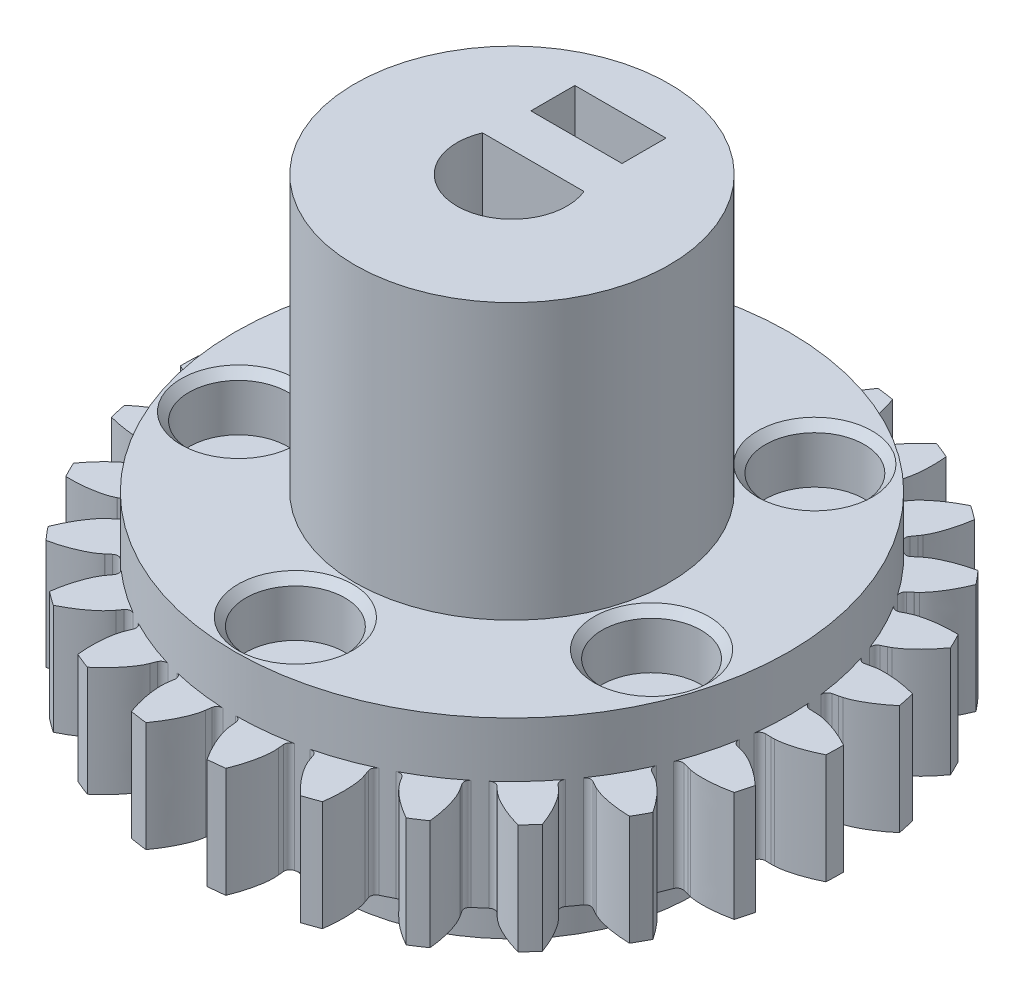
from build123d import *

# Parameters (mm, degrees)
BOSS_EXTRUDE2_DEPTH = 7
CIRPATTERN1_COUNT   = 26
FILLET2_R           = 0.375
SKETCH3_R           = 10
BOSS_EXTRUDE3_DEPTH = 21
CUT_EXTRUDE1_DEPTH  = 10
SKETCH6_R           = 1.6
CUT_EXTRUDE2_DEPTH  = 15
SKETCH8_W           = 5.8
SKETCH8_H           = 2.8
CUT_EXTRUDE4_DEPTH  = 8.8
SKETCH9_R           = 11.5
SKETCH9_R_2         = 9.65
BOSS_EXTRUDE4_DEPTH = 6
SKETCH10_R          = 17.625
SKETCH10_R_2        = 10
SKETCH10_R_3        = 3.15
BOSS_EXTRUDE5_DEPTH = 3.5
CHAMFER1_SIZE       = 0.5


with BuildPart() as part:
    # Sketch1 → Boss-Extrude2 (new body)
    with BuildSketch(Plane(origin=(0, 0, 0), x_dir=(1, 0, 0), z_dir=(0, 1, 0))):
        with BuildLine():
            add(Edge.make_bspline(
                [(13.04324728, 12.87221625), (13.106541248, 12.928570983), (13.172712284, 12.981186998), (13.241136986, 13.030696548)],
                knots=[0.000110235, 0.000110235, 0.000110235, 0.000110235, 0.070248199, 0.070248199, 0.070248199, 0.070248199], degree=3))
            Line((13.04324728, 12.87221625), (14.994199295, 10.921264235))
            add(Edge.make_bspline(
                [(14.994199295, 10.921264235), (15.156199197, 11.078539273), (15.298507984, 11.255888704), (15.431102636, 11.439593369)],
                knots=[0.062510625, 0.062510625, 0.062510625, 0.062510625, 0.250010852, 0.250010852, 0.250010852, 0.250010852], degree=3))
            Line((15.431102636, 11.439593369), (13.241136986, 13.030696548))
        make_face()
        with BuildLine():
            Line((14.994199295, 10.921264235), (13.04324728, 12.87221625))
            add(Edge.make_bspline(
                [(13.042948867, 12.871950507), (13.043048331, 12.872039097), (13.043147802, 12.872127678), (13.04324728, 12.87221625)],
                knots=[0, 0, 0, 0, 0.000110235, 0.000110235, 0.000110235, 0.000110235], degree=3))
            ThreePointArc((13.042948867, 12.871950507), (13.973627411, 11.855098565), (14.825236422, 10.771164748))
            add(Edge.make_bspline(
                [(14.825236422, 10.771164748), (14.912631208, 10.843375876), (14.994199295, 10.921264235)],
                knots=[0, 0, 0, 0.250031649, 0.250031649, 0.250031649], degree=2))
        make_face()
        with BuildLine():
            ThreePointArc((14.825236422, 10.771164748), (13.973627411, 11.855098565), (13.042948867, 12.871950507))
            Line((13.042948867, 12.871950507), (14.825236422, 10.771164748))
        make_face()
        with BuildLine():
            Line((14.825236422, 10.771164748), (13.042948867, 12.871950507))
            Line((13.042948867, 12.871950507), (12.507592838, 12.417759315))
            ThreePointArc((12.507592838, 12.417759315), (13.439846282, 11.402243503), (14.289880393, 10.316973556))
            Line((14.289880393, 10.316973556), (14.825236422, 10.771164748))
        make_face()
        with BuildLine():
            add(Edge.make_bspline(
                [(13.241136986, 13.030696548), (13.416508573, 13.157588856), (13.663595297, 13.295941653), (13.917955055, 13.417816485), (13.976901471, 13.4450413)],
                knots=[0.070248199, 0.070248199, 0.070248199, 0.070248199, 0.250010852, 0.303805728, 0.303805728, 0.303805728, 0.303805728], degree=3))
            Line((13.241136986, 13.030696548), (15.431102636, 11.439593369))
            add(Edge.make_bspline(
                [(15.431102636, 11.439593369), (15.652090738, 11.745763676), (15.846095862, 12.069586935), (16.017672277, 12.405216638)],
                knots=[0.250010852, 0.250010852, 0.250010852, 0.250010852, 0.562507008, 0.562507008, 0.562507008, 0.562507008], degree=3))
            Line((16.017672277, 12.405216638), (13.976901471, 13.4450413))
        make_face()
        with BuildLine():
            ThreePointArc((14.289880393, 10.316973556), (13.439846282, 11.402243503), (12.507592838, 12.417759315))
            ThreePointArc((12.507592838, 12.417759315), (-16.295504729, -6.715441208), (17.625, 0))
            ThreePointArc((17.625, 0), (16.770506357, 5.421322859), (14.289880393, 10.316973556))
        make_face()
        with BuildLine():
            add(Edge.make_bspline(
                [(13.976901471, 13.4450413), (14.5125687, 13.692442957), (15.077981381, 13.869949575), (15.653897684, 13.998410171)],
                knots=[0.303805728, 0.303805728, 0.303805728, 0.303805728, 0.792659062, 0.792659062, 0.792659062, 0.792659062], degree=3))
            Line((13.976901471, 13.4450413), (16.017672277, 12.405216638))
            add(Edge.make_bspline(
                [(16.017672277, 12.405216638), (16.144037556, 12.652406447), (16.258236925, 12.906000376), (16.362089788, 13.163662779)],
                knots=[0.562507008, 0.562507008, 0.562507008, 0.562507008, 0.792659062, 0.792659062, 0.792659062, 0.792659062], degree=3))
            ThreePointArc((16.362089788, 13.163662779), (16.013433868, 13.585651834), (15.653897684, 13.998410171))
        make_face()
    boss_extrude2 = extrude(amount=BOSS_EXTRUDE2_DEPTH)

    # CirPattern1: Boss-Extrude2 ×26 about axis
    cirpattern1_axis = Axis((0, -16.866091491, 0), (0, 1, 0))
    for i in range(1, CIRPATTERN1_COUNT):
        add(boss_extrude2.rotate(cirpattern1_axis, i * 360 / CIRPATTERN1_COUNT))

    # Fillet2
    fillet2_edges = [part.edges().sort_by_distance(p)[0] for p in [
        (11.816733548, 3.5, -14.006085579),
        (11.405629059, 3.5, -13.436973274),
        (9.172380602, 3.5, -15.050184686),
        (9.583485091, 3.5, -15.619296991),
        (8.121485073, 3.5, -16.427023626),
        (7.858524023, 3.5, -15.776064946),
        (5.304102946, 3.5, -16.807948029),
        (5.567063997, 3.5, -17.458906709),
        (3.954245406, 3.5, -17.89328277),
        (3.854710135, 3.5, -17.198309067),
        (1.127570107, 3.5, -17.588894526),
        (1.227105378, 3.5, -18.283868228),
        (-0.442800631, 3.5, -18.319649358),
        (-0.373125495, 3.5, -17.621049979),
        (-3.114493009, 3.5, -17.347638407),
        (-3.184168145, 3.5, -18.046237786),
        (-4.814112705, 3.5, -17.681344515),
        (-4.579276428, 3.5, -17.019719516),
        (-7.175553112, 3.5, -16.0982006),
        (-7.410389389, 3.5, -16.759825599),
        (-8.905646048, 3.5, -16.015464198),
        (-8.519296459, 3.5, -15.429264819),
        (-10.81959615, 3.5, -13.913193888),
        (-11.205945738, 3.5, -14.499393267),
        (-12.479615612, 3.5, -13.418823315),
        (-11.964205947, 3.5, -12.942117333),
        (-13.834843587, 3.5, -10.91960292),
        (-14.350253252, 3.5, -11.396308902),
        (-15.328315279, 3.5, -10.042329197),
        (-14.713799273, 3.5, -9.702821031),
        (-16.046060203, 3.5, -7.291404321),
        (-16.660576209, 3.5, -7.630912488),
        (-17.286188978, 3.5, -6.082211409),
        (-16.608280068, 3.5, -5.899632039),
        (-17.324738124, 3.5, -3.239455807),
        (-18.002647035, 3.5, -3.422035177),
        (-18.239452206, 3.5, -1.768617601),
        (-17.537547994, 3.5, -1.753577877),
        (-17.596565239, 3.5, 1.000758104),
        (-18.298469452, 3.5, 0.98571838),
        (-18.13270477, 3.5, 2.647761833),
        (-17.447597377, 3.5, 2.494387858),
        (-16.845743943, 3.5, 5.182811592),
        (-17.530851337, 3.5, 5.336185568),
        (-16.972150442, 3.5, 6.910262974),
        (-16.343655819, 3.5, 6.597388836),
        (-15.115909241, 3.5, 9.063658909),
        (-15.744403864, 3.5, 9.376533047),
        (-14.825236422, 3.5, 10.771164748),
        (-14.289880393, 3.5, 10.316973556),
        (-12.507592838, 3.5, 12.417759315),
        (-13.042948867, 3.5, 12.871950507),
        (-11.816733548, 3.5, 14.006085579),
        (-11.405629059, 3.5, 13.436973274),
        (-9.172380602, 3.5, 15.050184686),
        (-9.583485091, 3.5, 15.619296991),
        (-8.121485073, 3.5, 16.427023626),
        (-7.858524023, 3.5, 15.776064946),
        (-5.304102946, 3.5, 16.807948029),
        (-5.567063997, 3.5, 17.458906709),
        (-3.954245406, 3.5, 17.89328277),
        (-3.854710135, 3.5, 17.198309067),
        (-1.127570107, 3.5, 17.588894526),
        (-1.227105378, 3.5, 18.283868228),
        (0.442800631, 3.5, 18.319649358),
        (0.373125495, 3.5, 17.621049979),
        (3.114493009, 3.5, 17.347638407),
        (3.184168145, 3.5, 18.046237786),
        (4.814112705, 3.5, 17.681344515),
        (7.175553112, 3.5, 16.0982006),
        (7.410389389, 3.5, 16.759825599),
        (8.905646048, 3.5, 16.015464198),
        (10.81959615, 3.5, 13.913193888),
        (11.205945738, 3.5, 14.499393267),
        (12.479615612, 3.5, 13.418823315),
        (13.834843587, 3.5, 10.91960292),
        (14.350253252, 3.5, 11.396308902),
        (15.328315279, 3.5, 10.042329197),
        (16.046060203, 3.5, 7.291404321),
        (16.660576209, 3.5, 7.630912488),
        (17.286188978, 3.5, 6.082211409),
        (16.608280068, 3.5, 5.899632039),
        (17.324738124, 3.5, 3.239455807),
        (18.002647035, 3.5, 3.422035177),
        (18.239452206, 3.5, 1.768617601),
        (17.537547994, 3.5, 1.753577877),
        (17.596565239, 3.5, -1.000758104),
        (18.298469452, 3.5, -0.98571838),
        (18.13270477, 3.5, -2.647761833),
        (17.447597377, 3.5, -2.494387858),
        (16.845743943, 3.5, -5.182811592),
        (17.530851337, 3.5, -5.336185568),
        (16.972150442, 3.5, -6.910262974),
        (16.343655819, 3.5, -6.597388836),
        (15.115909241, 3.5, -9.063658909),
        (15.744403864, 3.5, -9.376533047),
        (14.825236422, 3.5, -10.771164748),
        (14.289880393, 3.5, -10.316973556),
        (12.507592838, 3.5, -12.417759315),
        (13.042948867, 3.5, -12.871950507),
        (14.713799273, 3.5, 9.702821031),
        (11.964205947, 3.5, 12.942117333),
        (8.519296459, 3.5, 15.429264819),
        (4.579276428, 3.5, 17.019719516),
    ]]
    fillet(fillet2_edges, radius=FILLET2_R)

    # Sketch3 → Boss-Extrude3 (add)
    with BuildSketch(Plane(origin=(0, 7, 0), x_dir=(1, 0, 0), z_dir=(0, 1, 0))):
        with Locations(Location((0, 0, 0), (0, 0, 90))):
            Circle(SKETCH3_R)
    extrude(amount=BOSS_EXTRUDE3_DEPTH)

    # Sketch4 → Cut-Extrude1 (cut)
    with BuildSketch(Plane(origin=(0, 28, 0), x_dir=(1, 0, 0), z_dir=(0, 1, 0))):
        with BuildLine():
            Line((3.229163978, 1.35), (-3.229163978, 1.35))
            ThreePointArc((-3.229163978, 1.35), (-0.688449735, -3.43162308), (3.5, 0))
            ThreePointArc((3.5, 0), (3.43162308, 0.688449735), (3.229163978, 1.35))
        make_face()
    extrude(amount=-CUT_EXTRUDE1_DEPTH, mode=Mode.SUBTRACT)

    # Sketch6 → Cut-Extrude2 (cut)
    with BuildSketch(Plane(origin=(0, 28, -10), x_dir=(-1, 0, 0), z_dir=(0, 0, -1))):
        with Locations((0, -5)):
            Circle(SKETCH6_R)
    extrude(amount=-CUT_EXTRUDE2_DEPTH, mode=Mode.SUBTRACT)

    # Sketch8 → Cut-Extrude4 (cut)
    with BuildSketch(Plane(origin=(0, 28, 0), x_dir=(1, 0, 0), z_dir=(0, 1, 0))):
        with Locations((0, 5.5)):
            Rectangle(SKETCH8_W, SKETCH8_H)
    extrude(amount=-CUT_EXTRUDE4_DEPTH, mode=Mode.SUBTRACT)

    # Sketch9 → Boss-Extrude4 (add)
    with BuildSketch(Plane.XZ):
        with Locations(Location((0, 0, 0), (0, 0, 90))):
            Circle(SKETCH9_R)
        with Locations(Location((0, 0, 0), (0, 0, 270))):
            Circle(SKETCH9_R_2, mode=Mode.SUBTRACT)
    extrude(amount=BOSS_EXTRUDE4_DEPTH)

    # Sketch10 → Boss-Extrude5 (add)
    with BuildSketch(Plane(origin=(0, 7, 0), x_dir=(1, 0, 0), z_dir=(0, 1, 0))):
        with Locations(Location((0, 0, 0), (0, 0, 90.108405468))):
            Circle(SKETCH10_R)
        with Locations(Location((0, 0, 0), (0, 0, 270))):
            Circle(SKETCH10_R_2, mode=Mode.SUBTRACT)
        with Locations(Location((0.016618927, -13.8, 0), (0, 0, 270))):
            Circle(SKETCH10_R_3, mode=Mode.SUBTRACT)
        with Locations(Location((-13.119444394, -4.280240061, 0), (0, 0, 270))):
            Circle(SKETCH10_R_3, mode=Mode.SUBTRACT)
        with Locations(Location((-8.124881476, 11.154666162, 0), (0, 0, 270))):
            Circle(SKETCH10_R_3, mode=Mode.SUBTRACT)
        with Locations(Location((8.097991488, 11.174202882, 0), (0, 0, 270))):
            Circle(SKETCH10_R_3, mode=Mode.SUBTRACT)
        with Locations(Location((13.129715456, -4.248628984, 0), (0, 0, 270))):
            Circle(SKETCH10_R_3, mode=Mode.SUBTRACT)
    extrude(amount=BOSS_EXTRUDE5_DEPTH)

    # Chamfer1
    chamfer1_edges = [part.edges().sort_by_distance(p)[0] for p in [
        (0.016618927, 10.5, 10.65),
        (-13.119444394, 10.5, 1.130240061),
        (-8.124881476, 10.5, -14.304666162),
        (8.097991488, 10.5, -14.324202882),
        (13.129715456, 10.5, 1.098628984),
    ]]
    chamfer(chamfer1_edges, length=CHAMFER1_SIZE)


solid = part.part
